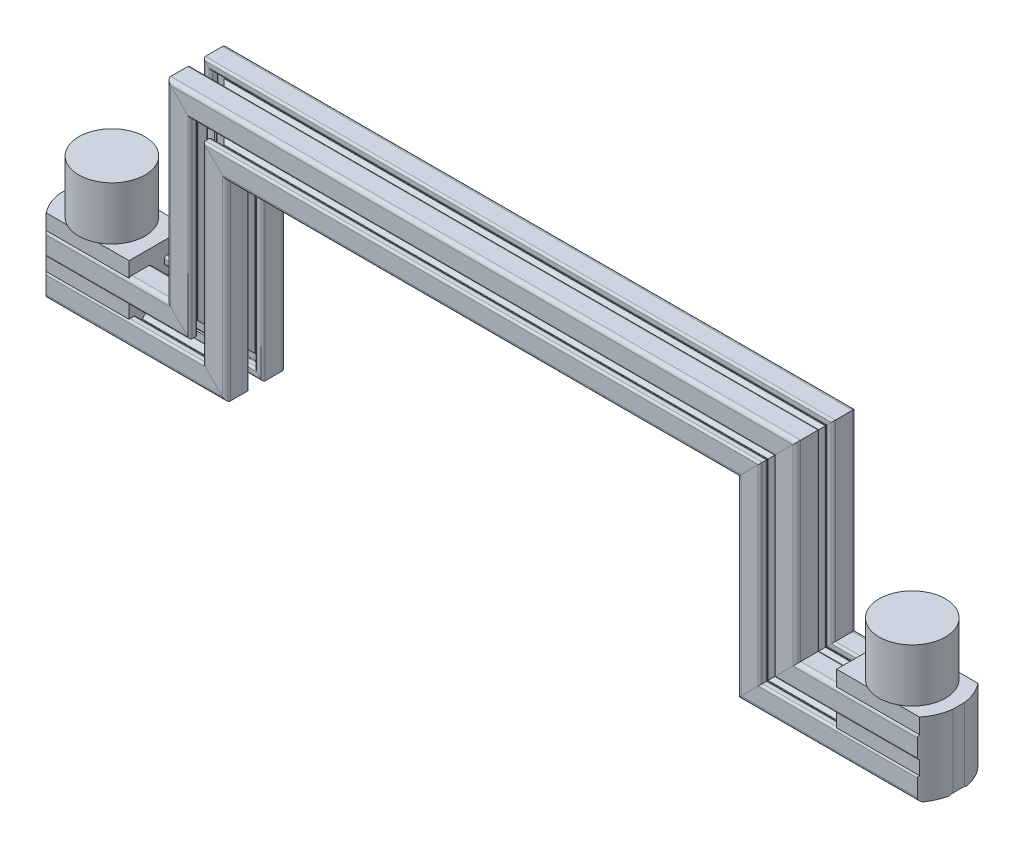
from build123d import *

# Parameters (mm, degrees)
SKETCH6_W            = 44.121320344
SKETCH6_H            = 54.791290411
BOSS_EXTRUDE3_DEPTH  = 70
SKETCH4_R            = 25
FL_WHEEL_MOUNT_DEPTH = 40
CUT_EXTRUDE1_DEPTH   = 364.866108112


with BuildPart() as part:
    # Sweep1: sweep along a path in Sketch1
    with BuildLine(Plane.XY) as sweep1_path:
        Line((0, 0), (125, 0))
        Line((125, 0), (125, 144.694323918))
        Line((125, 144.694323918), (337, 144.694323918))
    # Sketch7 → Sweep1 (sweep)
    with BuildSketch(Plane(origin=(0, 0, 0), x_dir=(0, 0, -1), z_dir=(1, 0, 0))):
        with BuildLine():
            Line((4.905816029, 11.21531926), (4.005816103, 10.700171216))
            Line((4.005816103, 10.700171216), (3.105816176, 11.21531926))
            Line((3.105816176, 11.21531926), (-2.197508215, 11.21531926))
            ThreePointArc((-2.197508215, 11.21531926), (-2.342927919, 11.244245037), (-2.466208792, 11.326618683))
            Line((-2.466208792, 11.326618683), (-5.932884474, 14.793294365))
            ThreePointArc((-5.932884474, 14.793294365), (-6.01525812, 14.916575238), (-6.044183897, 15.061994942))
            Line((-6.044183897, 15.061994942), (-6.044183897, 19.35531926))
            ThreePointArc((-6.044183897, 19.35531926), (-5.932884474, 19.624019836), (-5.664183897, 19.73531926))
            Line((-5.664183897, 19.73531926), (-2.579183897, 19.73531926))
            ThreePointArc((-2.579183897, 19.73531926), (-1.50438159, 20.180516952), (-1.059183897, 21.25531926))
            Line((-1.059183897, 21.25531926), (-1.059183897, 24.21531926))
            ThreePointArc((-1.059183897, 24.21531926), (-1.50438159, 25.290121567), (-2.579183897, 25.73531926))
            Line((-2.579183897, 25.73531926), (-15.494183897, 25.73531926))
            ThreePointArc((-15.494183897, 25.73531926), (-17.615504241, 24.856639603), (-18.494183897, 22.73531926))
            Line((-18.494183897, 22.73531926), (-18.494183897, 9.82031926))
            ThreePointArc((-18.494183897, 9.82031926), (-18.048986205, 8.745516952), (-16.974183897, 8.30031926))
            Line((-16.974183897, 8.30031926), (-14.014183897, 8.30031926))
            ThreePointArc((-14.014183897, 8.30031926), (-12.93938159, 8.745516952), (-12.494183897, 9.82031926))
            Line((-12.494183897, 9.82031926), (-12.494183897, 12.90531926))
            ThreePointArc((-12.494183897, 12.90531926), (-12.382884474, 13.174019836), (-12.114183897, 13.28531926))
            Line((-12.114183897, 13.28531926), (-7.813788512, 13.28531926))
            ThreePointArc((-7.813788512, 13.28531926), (-7.668368808, 13.256393482), (-7.545087935, 13.174019836))
            Line((-7.545087935, 13.174019836), (-4.08548332, 9.714415222))
            ThreePointArc((-4.08548332, 9.714415222), (-4.003109675, 9.591134349), (-3.974183897, 9.445714645))
            Line((-3.974183897, 9.445714645), (-3.974183897, 4.135318895))
            Line((-3.974183897, 4.135318895), (-3.454570628, 3.23531926))
            Line((-3.454570628, 3.23531926), (-3.974183897, 2.335319624))
            Line((-3.974183897, 2.335319624), (-3.974183897, -2.968005058))
            ThreePointArc((-3.974183897, -2.968005058), (-4.003109675, -3.113424762), (-4.08548332, -3.236705635))
            Line((-4.08548332, -3.236705635), (-7.552159003, -6.703381317))
            ThreePointArc((-7.552159003, -6.703381317), (-7.675439876, -6.785754963), (-7.82085958, -6.81468074))
            Line((-7.82085958, -6.81468074), (-12.114183897, -6.81468074))
            ThreePointArc((-12.114183897, -6.81468074), (-12.382884474, -6.703381317), (-12.494183897, -6.43468074))
            Line((-12.494183897, -6.43468074), (-12.494183897, -3.34968074))
            ThreePointArc((-12.494183897, -3.34968074), (-12.93938159, -2.274878433), (-14.014183897, -1.82968074))
            Line((-14.014183897, -1.82968074), (-16.974183897, -1.82968074))
            ThreePointArc((-16.974183897, -1.82968074), (-18.048986205, -2.274878433), (-18.494183897, -3.34968074))
            Line((-18.494183897, -3.34968074), (-18.494183897, -16.26468074))
            ThreePointArc((-18.494183897, -16.26468074), (-17.615504241, -18.386001084), (-15.494183897, -19.26468074))
            Line((-15.494183897, -19.26468074), (-2.579183897, -19.26468074))
            ThreePointArc((-2.579183897, -19.26468074), (-1.50438159, -18.819483048), (-1.059183897, -17.74468074))
            Line((-1.059183897, -17.74468074), (-1.059183897, -14.78468074))
            ThreePointArc((-1.059183897, -14.78468074), (-1.50438159, -13.709878433), (-2.579183897, -13.26468074))
            Line((-2.579183897, -13.26468074), (-5.664183897, -13.26468074))
            ThreePointArc((-5.664183897, -13.26468074), (-5.932884474, -13.153381317), (-6.044183897, -12.88468074))
            Line((-6.044183897, -12.88468074), (-6.044183897, -8.584285355))
            ThreePointArc((-6.044183897, -8.584285355), (-6.01525812, -8.438865651), (-5.932884474, -8.315584778))
            Line((-5.932884474, -8.315584778), (-2.473279859, -4.855980164))
            ThreePointArc((-2.473279859, -4.855980164), (-2.349998987, -4.773606518), (-2.204579283, -4.74468074))
            Line((-2.204579283, -4.74468074), (3.105816176, -4.74468074))
            Line((3.105816176, -4.74468074), (4.005816103, -4.229532697))
            Line((4.005816103, -4.229532697), (4.905816029, -4.74468074))
            Line((4.905816029, -4.74468074), (10.20914042, -4.74468074))
            ThreePointArc((10.20914042, -4.74468074), (10.354560124, -4.773606518), (10.477840997, -4.855980164))
            Line((10.477840997, -4.855980164), (13.94451668, -8.322655846))
            ThreePointArc((13.94451668, -8.322655846), (14.026890325, -8.445936719), (14.055816103, -8.591356423))
            Line((14.055816103, -8.591356423), (14.055816103, -12.88468074))
            ThreePointArc((14.055816103, -12.88468074), (13.94451668, -13.153381317), (13.675816103, -13.26468074))
            Line((13.675816103, -13.26468074), (10.590816103, -13.26468074))
            ThreePointArc((10.590816103, -13.26468074), (9.516013795, -13.709878433), (9.070816103, -14.78468074))
            Line((9.070816103, -14.78468074), (9.070816103, -17.74468074))
            ThreePointArc((9.070816103, -17.74468074), (9.516013795, -18.819483048), (10.590816103, -19.26468074))
            Line((10.590816103, -19.26468074), (23.505816103, -19.26468074))
            ThreePointArc((23.505816103, -19.26468074), (25.627136446, -18.386001084), (26.505816103, -16.26468074))
            Line((26.505816103, -16.26468074), (26.505816103, -3.34968074))
            ThreePointArc((26.505816103, -3.34968074), (26.06061841, -2.274878433), (24.985816103, -1.82968074))
            Line((24.985816103, -1.82968074), (22.025816103, -1.82968074))
            ThreePointArc((22.025816103, -1.82968074), (20.951013795, -2.274878433), (20.505816103, -3.34968074))
            Line((20.505816103, -3.34968074), (20.505816103, -6.43468074))
            ThreePointArc((20.505816103, -6.43468074), (20.39451668, -6.703381317), (20.125816103, -6.81468074))
            Line((20.125816103, -6.81468074), (15.825420717, -6.81468074))
            ThreePointArc((15.825420717, -6.81468074), (15.680001013, -6.785754963), (15.556720141, -6.703381317))
            Line((15.556720141, -6.703381317), (12.097115526, -3.243776702))
            ThreePointArc((12.097115526, -3.243776702), (12.01474188, -3.12049583), (11.985816103, -2.975076126))
            Line((11.985816103, -2.975076126), (11.985816103, 2.335319624))
            Line((11.985816103, 2.335319624), (11.466202833, 3.23531926))
            Line((11.466202833, 3.23531926), (11.985816103, 4.135318895))
            Line((11.985816103, 4.135318895), (11.985816103, 9.438643577))
            ThreePointArc((11.985816103, 9.438643577), (12.01474188, 9.584063281), (12.097115526, 9.707344154))
            Line((12.097115526, 9.707344154), (15.563791208, 13.174019836))
            ThreePointArc((15.563791208, 13.174019836), (15.687072081, 13.256393482), (15.832491785, 13.28531926))
            Line((15.832491785, 13.28531926), (20.125816103, 13.28531926))
            ThreePointArc((20.125816103, 13.28531926), (20.39451668, 13.174019836), (20.505816103, 12.90531926))
            Line((20.505816103, 12.90531926), (20.505816103, 9.82031926))
            ThreePointArc((20.505816103, 9.82031926), (20.951013795, 8.745516952), (22.025816103, 8.30031926))
            Line((22.025816103, 8.30031926), (24.985816103, 8.30031926))
            ThreePointArc((24.985816103, 8.30031926), (26.06061841, 8.745516952), (26.505816103, 9.82031926))
            Line((26.505816103, 9.82031926), (26.505816103, 22.73531926))
            ThreePointArc((26.505816103, 22.73531926), (25.627136446, 24.856639603), (23.505816103, 25.73531926))
            Line((23.505816103, 25.73531926), (10.590816103, 25.73531926))
            ThreePointArc((10.590816103, 25.73531926), (9.516013795, 25.290121567), (9.070816103, 24.21531926))
            Line((9.070816103, 24.21531926), (9.070816103, 21.25531926))
            ThreePointArc((9.070816103, 21.25531926), (9.516013795, 20.180516952), (10.590816103, 19.73531926))
            Line((10.590816103, 19.73531926), (13.675816103, 19.73531926))
            ThreePointArc((13.675816103, 19.73531926), (13.94451668, 19.624019836), (14.055816103, 19.35531926))
            Line((14.055816103, 19.35531926), (14.055816103, 15.054923874))
            ThreePointArc((14.055816103, 15.054923874), (14.026890325, 14.90950417), (13.94451668, 14.786223298))
            Line((13.94451668, 14.786223298), (10.484912065, 11.326618683))
            ThreePointArc((10.484912065, 11.326618683), (10.361631192, 11.244245037), (10.216211488, 11.21531926))
            Line((10.216211488, 11.21531926), (4.905816029, 11.21531926))
        make_face()
        with BuildLine():
            Line((13.969837884, 21.274341041), (13.529837884, 21.274341041))
            ThreePointArc((13.529837884, 21.274341041), (12.469177713, 21.713680869), (12.029837884, 22.774341041))
            Line((12.029837884, 22.774341041), (12.029837884, 23.274341041))
            ThreePointArc((12.029837884, 23.274341041), (12.469177713, 24.335001213), (13.529837884, 24.774341041))
            Line((13.529837884, 24.774341041), (23.139837884, 24.774341041))
            ThreePointArc((23.139837884, 24.774341041), (24.752041345, 24.106544502), (25.419837884, 22.494341041))
            Line((25.419837884, 22.494341041), (25.419837884, 12.884341041))
            ThreePointArc((25.419837884, 12.884341041), (24.980498056, 11.823680869), (23.919837884, 11.384341041))
            Line((23.919837884, 11.384341041), (23.419837884, 11.384341041))
            ThreePointArc((23.419837884, 11.384341041), (22.359177713, 11.823680869), (21.919837884, 12.884341041))
            Line((21.919837884, 12.884341041), (21.919837884, 13.324341041))
            ThreePointArc((21.919837884, 13.324341041), (21.626944666, 14.031447822), (20.919837884, 14.324341041))
            Line((20.919837884, 14.324341041), (15.349837884, 14.324341041))
            ThreePointArc((15.349837884, 14.324341041), (15.081137307, 14.435640464), (14.969837884, 14.704341041))
            Line((14.969837884, 14.704341041), (14.969837884, 20.274341041))
            ThreePointArc((14.969837884, 20.274341041), (14.676944666, 20.981447822), (13.969837884, 21.274341041))
        make_face(mode=Mode.SUBTRACT)
        with BuildLine():
            Line((21.958859666, -6.68968074), (21.958859666, -6.24968074))
            ThreePointArc((21.958859666, -6.24968074), (22.398199494, -5.189020569), (23.458859666, -4.74968074))
            Line((23.458859666, -4.74968074), (23.958859666, -4.74968074))
            ThreePointArc((23.958859666, -4.74968074), (25.019519838, -5.189020569), (25.458859666, -6.24968074))
            Line((25.458859666, -6.24968074), (25.458859666, -15.85968074))
            ThreePointArc((25.458859666, -15.85968074), (24.791063127, -17.471884201), (23.178859666, -18.13968074))
            Line((23.178859666, -18.13968074), (13.568859666, -18.13968074))
            ThreePointArc((13.568859666, -18.13968074), (12.508199494, -17.700340912), (12.068859666, -16.63968074))
            Line((12.068859666, -16.63968074), (12.068859666, -16.13968074))
            ThreePointArc((12.068859666, -16.13968074), (12.508199494, -15.079020569), (13.568859666, -14.63968074))
            Line((13.568859666, -14.63968074), (14.008859666, -14.63968074))
            ThreePointArc((14.008859666, -14.63968074), (14.715966447, -14.346787522), (15.008859666, -13.63968074))
            Line((15.008859666, -13.63968074), (15.008859666, -8.06968074))
            ThreePointArc((15.008859666, -8.06968074), (15.120159089, -7.800980164), (15.388859666, -7.68968074))
            Line((15.388859666, -7.68968074), (20.958859666, -7.68968074))
            ThreePointArc((20.958859666, -7.68968074), (21.665966447, -7.396787522), (21.958859666, -6.68968074))
        make_face(mode=Mode.SUBTRACT)
        with BuildLine():
            Line((-6.005162116, -14.678702522), (-5.565162116, -14.678702522))
            ThreePointArc((-5.565162116, -14.678702522), (-4.504501944, -15.11804235), (-4.065162116, -16.178702522))
            Line((-4.065162116, -16.178702522), (-4.065162116, -16.678702522))
            ThreePointArc((-4.065162116, -16.678702522), (-4.504501944, -17.739362694), (-5.565162116, -18.178702522))
            Line((-5.565162116, -18.178702522), (-15.175162116, -18.178702522))
            ThreePointArc((-15.175162116, -18.178702522), (-16.787365577, -17.510905983), (-17.455162116, -15.898702522))
            Line((-17.455162116, -15.898702522), (-17.455162116, -6.288702522))
            ThreePointArc((-17.455162116, -6.288702522), (-17.015822287, -5.22804235), (-15.955162116, -4.788702522))
            Line((-15.955162116, -4.788702522), (-15.455162116, -4.788702522))
            ThreePointArc((-15.455162116, -4.788702522), (-14.394501944, -5.22804235), (-13.955162116, -6.288702522))
            Line((-13.955162116, -6.288702522), (-13.955162116, -6.728702522))
            ThreePointArc((-13.955162116, -6.728702522), (-13.662268897, -7.435809303), (-12.955162116, -7.728702522))
            Line((-12.955162116, -7.728702522), (-7.385162116, -7.728702522))
            ThreePointArc((-7.385162116, -7.728702522), (-7.116461539, -7.840001945), (-7.005162116, -8.108702522))
            Line((-7.005162116, -8.108702522), (-7.005162116, -13.678702522))
            ThreePointArc((-7.005162116, -13.678702522), (-6.712268897, -14.385809303), (-6.005162116, -14.678702522))
        make_face(mode=Mode.SUBTRACT)
        with BuildLine():
            Line((1.828915922, -2.488564034), (1.413170132, -2.316356489))
            ThreePointArc((1.413170132, -2.316356489), (0.823336155, -1.625307126), (1.036269925, -0.742067321))
            ThreePointArc((1.036269925, -0.742067321), (0.446703204, -0.237613869), (-0.057716637, 0.351981608))
            ThreePointArc((-0.057716637, 0.351981608), (-0.940937171, 0.139101897), (-1.631952253, 0.728927667))
            Line((-1.631952253, 0.728927667), (-1.804159798, 1.144673456))
            ThreePointArc((-1.804159798, 1.144673456), (-1.732589712, 2.050394753), (-0.957477943, 2.524372695))
            ThreePointArc((-0.957477943, 2.524372695), (-1.017662114, 3.297961778), (-0.957433843, 4.071547428))
            ThreePointArc((-0.957433843, 4.071547428), (-1.73249376, 4.54554997), (-1.804045409, 5.451241222))
            Line((-1.804045409, 5.451241222), (-1.631837865, 5.866987012))
            ThreePointArc((-1.631837865, 5.866987012), (-0.940788501, 6.456820989), (-0.057548696, 6.243887219))
            ThreePointArc((-0.057548696, 6.243887219), (0.446904755, 6.83345394), (1.036500233, 7.33787378))
            ThreePointArc((1.036500233, 7.33787378), (0.823620522, 8.221094315), (1.413446291, 8.912109397))
            Line((1.413446291, 8.912109397), (1.829192081, 9.084316942))
            ThreePointArc((1.829192081, 9.084316942), (2.734913377, 9.012746856), (3.20889132, 8.237635087))
            ThreePointArc((3.20889132, 8.237635087), (3.982480402, 8.297819258), (4.756066053, 8.237590987))
            ThreePointArc((4.756066053, 8.237590987), (5.230068594, 9.012650904), (6.135759847, 9.084202553))
            Line((6.135759847, 9.084202553), (6.551505636, 8.911995008))
            ThreePointArc((6.551505636, 8.911995008), (7.141339614, 8.220945645), (6.928405843, 7.33770584))
            ThreePointArc((6.928405843, 7.33770584), (7.517972564, 6.833252389), (8.022392405, 6.243656911))
            ThreePointArc((8.022392405, 6.243656911), (8.905612939, 6.456536622), (9.596628022, 5.866710852))
            Line((9.596628022, 5.866710852), (9.768835567, 5.450965063))
            ThreePointArc((9.768835567, 5.450965063), (9.697265481, 4.545243766), (8.922153712, 4.071265824))
            ThreePointArc((8.922153712, 4.071265824), (8.982337882, 3.297676741), (8.922109612, 2.524091091))
            ThreePointArc((8.922109612, 2.524091091), (9.697169528, 2.05008855), (9.768721178, 1.144397297))
            Line((9.768721178, 1.144397297), (9.596513633, 0.728651507))
            ThreePointArc((9.596513633, 0.728651507), (8.90546427, 0.13881753), (8.022224464, 0.351751301))
            ThreePointArc((8.022224464, 0.351751301), (7.517771013, -0.23781542), (6.928175536, -0.742235261))
            ThreePointArc((6.928175536, -0.742235261), (7.141055247, -1.625455795), (6.551229477, -2.316470878))
            Line((6.551229477, -2.316470878), (6.135483688, -2.488678423))
            ThreePointArc((6.135483688, -2.488678423), (5.229762391, -2.417108337), (4.755784449, -1.641996568))
            ThreePointArc((4.755784449, -1.641996568), (3.982195366, -1.702180738), (3.208609716, -1.641952468))
            ThreePointArc((3.208609716, -1.641952468), (2.734607174, -2.417012384), (1.828915922, -2.488564034))
        make_face(mode=Mode.SUBTRACT)
        with BuildLine():
            Line((-13.994183897, 13.28531926), (-13.994183897, 12.84531926))
            ThreePointArc((-13.994183897, 12.84531926), (-14.433523726, 11.784659088), (-15.494183897, 11.34531926))
            Line((-15.494183897, 11.34531926), (-15.994183897, 11.34531926))
            ThreePointArc((-15.994183897, 11.34531926), (-17.054844069, 11.784659088), (-17.494183897, 12.84531926))
            Line((-17.494183897, 12.84531926), (-17.494183897, 22.45531926))
            ThreePointArc((-17.494183897, 22.45531926), (-16.826387358, 24.067522721), (-15.214183897, 24.73531926))
            Line((-15.214183897, 24.73531926), (-5.604183897, 24.73531926))
            ThreePointArc((-5.604183897, 24.73531926), (-4.543523726, 24.295979431), (-4.104183897, 23.23531926))
            Line((-4.104183897, 23.23531926), (-4.104183897, 22.73531926))
            ThreePointArc((-4.104183897, 22.73531926), (-4.543523726, 21.674659088), (-5.604183897, 21.23531926))
            Line((-5.604183897, 21.23531926), (-6.044183897, 21.23531926))
            ThreePointArc((-6.044183897, 21.23531926), (-6.751290679, 20.942426041), (-7.044183897, 20.23531926))
            Line((-7.044183897, 20.23531926), (-7.044183897, 14.66531926))
            ThreePointArc((-7.044183897, 14.66531926), (-7.15548332, 14.396618683), (-7.424183897, 14.28531926))
            Line((-7.424183897, 14.28531926), (-12.994183897, 14.28531926))
            ThreePointArc((-12.994183897, 14.28531926), (-13.701290679, 13.992426041), (-13.994183897, 13.28531926))
        make_face(mode=Mode.SUBTRACT)
    sweep1 = sweep(path=sweep1_path.line, transition=Transition.RIGHT)

    # Sketch6 → Boss-Extrude3 (add)
    with BuildSketch(Plane.ZY):
        with Locations((-4.445155931, 9.009644122)):
            Rectangle(SKETCH6_W, SKETCH6_H)
    boss_extrude3 = extrude(amount=-BOSS_EXTRUDE3_DEPTH)

    # Sketch4 → FL Wheel Mount (add)
    with BuildSketch(Plane(origin=(0, 36.405289327, 0), x_dir=(1, 0, 0), z_dir=(0, 1, 0))):
        with Locations((35, 4.445155931)):
            Circle(SKETCH4_R)
    fl_wheel_mount = extrude(amount=FL_WHEEL_MOUNT_DEPTH)

    # Sketch5 → Cut-Extrude1 (cut, through all)
    with BuildSketch(Plane(origin=(0, 36.405289327, 0), x_dir=(1, 0, 0), z_dir=(0, 1, 0))):
        with BuildLine():
            Line((35, -30.835992169), (35, -74.811013715))
            Line((35, -74.811013715), (-61.224063347, -74.811013715))
            Line((-61.224063347, -74.811013715), (-61.224063347, 58.492105505))
            Line((-61.224063347, 58.492105505), (35, 58.492105505))
            Line((35, 58.492105505), (35, 39.726304031))
            ThreePointArc((35, 39.726304031), (-0.2811481, 4.445155931), (35, -30.835992169))
        make_face()
    cut_extrude1 = extrude(amount=-CUT_EXTRUDE1_DEPTH, mode=Mode.SUBTRACT)

    # Mirror1: Sweep1, Boss-Extrude3, FL Wheel Mount, Cut-Extrude1 across plane
    add(sweep1.mirror(Plane(origin=(337, 0, 0), x_dir=(0, 0, 1), z_dir=(1, 0, 0))))
    add(boss_extrude3.mirror(Plane(origin=(337, 0, 0), x_dir=(0, 0, 1), z_dir=(1, 0, 0))))
    add(fl_wheel_mount.mirror(Plane(origin=(337, 0, 0), x_dir=(0, 0, 1), z_dir=(1, 0, 0))))
    add(cut_extrude1.mirror(Plane(origin=(337, 0, 0), x_dir=(0, 0, 1), z_dir=(1, 0, 0))), mode=Mode.SUBTRACT)


solid = part.part
